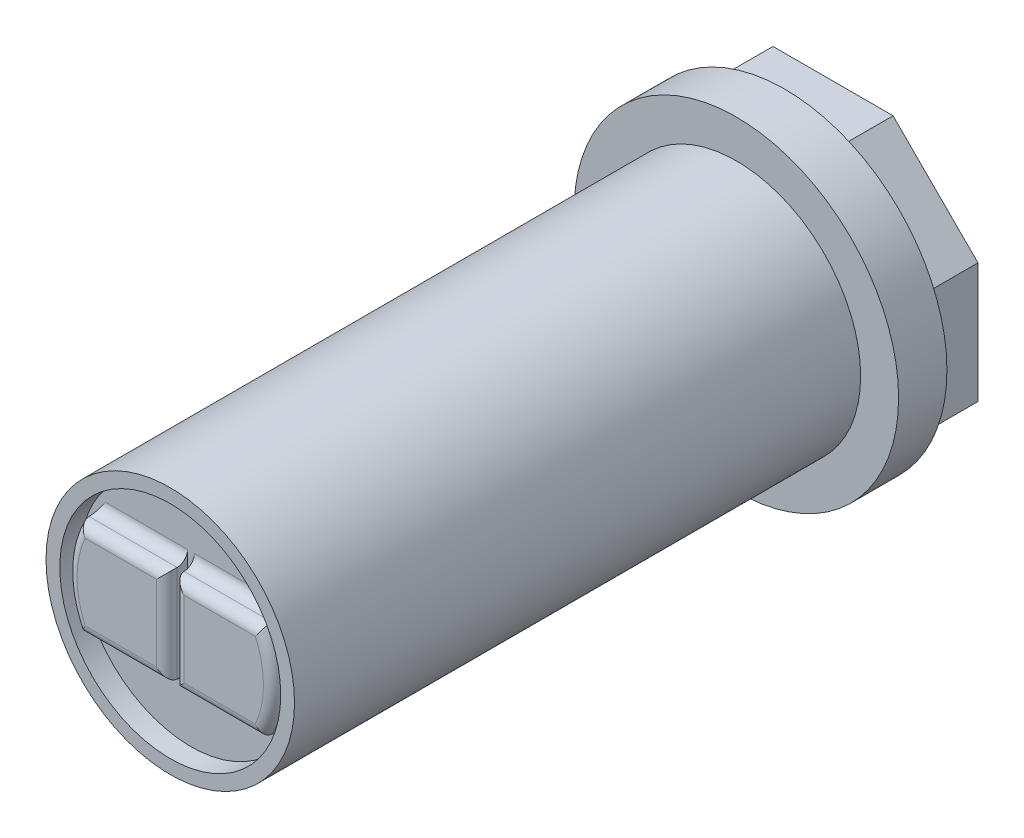
from build123d import *

# Parameters (mm, degrees)
SKETCH_1_R          = 9
EXTRUDE_1_DEPTH     = 48
EXTRUDE_2_DEPTH     = 3.5
SKETCH_3_R          = 11.75
EXTRUDE_3_DEPTH     = 3.5
SKETCH_4_R          = 8
CUT_EXTRUDE_1_DEPTH = 1.5
FILLET_1_R          = 0.75


with BuildPart() as part:
    # 草图1 → 凸台-拉伸1 (new body)
    with BuildSketch(Plane.XY):
        Circle(SKETCH_1_R)
    extrude(amount=EXTRUDE_1_DEPTH)

    # 草图2 → 凸台-拉伸2 (add)
    with BuildSketch(Plane(origin=(0, 0, 0), x_dir=(-1, 0, 0), z_dir=(0, 0, -1))):
        Polygon((-10.5, 4.349242405), (-10.5, -4.349242405), (-4.349242405, -10.5), (4.349242405, -10.5), (10.5, -4.349242405), (10.5, 4.349242405), (4.349242405, 10.5), (-4.349242405, 10.5), align=None)
    extrude(amount=-EXTRUDE_2_DEPTH)

    # 草图3 → 凸台-拉伸3 (add)
    with BuildSketch(Plane.XY.offset(3.5)):
        Circle(SKETCH_3_R)
    extrude(amount=EXTRUDE_3_DEPTH)

    # 草图4 → 切除-拉伸1 (cut)
    with BuildSketch(Plane.XY.offset(48)):
        Circle(SKETCH_4_R)
        with BuildLine():
            Line((6.633249581, -3.5), (0.25, -3.5))
            Line((0.25, -3.5), (0.25, 3.5))
            Line((0.25, 3.5), (6.633249581, 3.5))
            ThreePointArc((6.633249581, 3.5), (7.5, 0), (6.633249581, -3.5))
        make_face(mode=Mode.SUBTRACT)
        with BuildLine():
            Line((-0.25, -3.5), (-0.25, 3.5))
            Line((-0.25, 3.5), (-6.633249581, 3.5))
            ThreePointArc((-6.633249581, 3.5), (-7.5, 0), (-6.633249581, -3.5))
            Line((-6.633249581, -3.5), (-0.25, -3.5))
        make_face(mode=Mode.SUBTRACT)
    extrude(amount=-CUT_EXTRUDE_1_DEPTH, mode=Mode.SUBTRACT)

    # 圆角1
    fillet_1_edges = [part.edges().sort_by_distance(p)[0] for p in [
        (-3.44162479, 3.5, 46.5),
        (-3.44162479, -3.5, 48),
        (-7.5, 0, 48),
        (-0.25, 0, 48),
        (0.25, 0, 48),
        (3.44162479, -3.5, 48),
        (7.5, 0, 48),
        (3.44162479, 3.5, 48),
        (-3.44162479, -3.5, 46.5),
        (3.44162479, -3.5, 46.5),
        (3.44162479, 3.5, 46.5),
        (-3.44162479, 3.5, 48),
    ]]
    fillet(fillet_1_edges, radius=FILLET_1_R - 0.0001)  # a hair under: the kernel refuses the full size


solid = part.part
